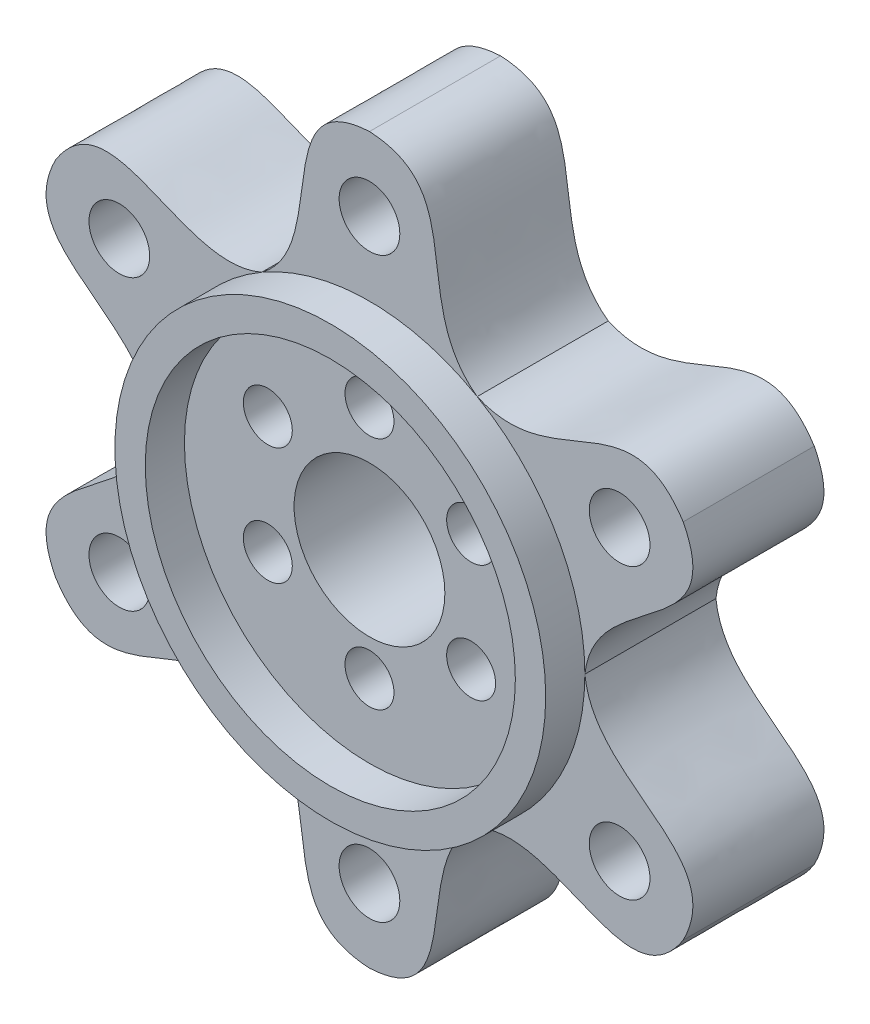
from build123d import *

# Parameters (mm, degrees)
SKETCH1_R           = 46.99
SKETCH1_R_2         = 9.779
SKETCH1_R_3         = 3.175
SKETCH1_R_4         = 3.937
BOSS_EXTRUDE3_DEPTH = 17.000000036
CUT_EXTRUDE1_START  = -22.86
CUT_EXTRUDE1_DEPTH  = 22.86
SKETCH4_R           = 27.94
SKETCH4_R_2         = 24.003
BOSS_EXTRUDE4_DEPTH = 5.08


with BuildPart() as part:
    # Sketch1 → Boss-Extrude3 (new body)
    with BuildSketch(Plane.XY):
        Circle(SKETCH1_R)
        Circle(SKETCH1_R_2, mode=Mode.SUBTRACT)
        with Locations((0, 16.002)):
            Circle(SKETCH1_R_3, mode=Mode.SUBTRACT)
        with Locations((13.184862266, 8.389716222)):
            Circle(SKETCH1_R_3, mode=Mode.SUBTRACT)
        with Locations((13.184862266, -6.834851335)):
            Circle(SKETCH1_R_3, mode=Mode.SUBTRACT)
        with Locations((0, -14.447135113)):
            Circle(SKETCH1_R_3, mode=Mode.SUBTRACT)
        with Locations((-13.184862266, -6.834851335)):
            Circle(SKETCH1_R_3, mode=Mode.SUBTRACT)
        with Locations((-13.184862266, 8.389716222)):
            Circle(SKETCH1_R_3, mode=Mode.SUBTRACT)
        with Locations((0, 37.465)):
            Circle(SKETCH1_R_4, mode=Mode.SUBTRACT)
        with Locations((32.445641753, 18.7325)):
            Circle(SKETCH1_R_4, mode=Mode.SUBTRACT)
        with Locations((32.445641753, -18.7325)):
            Circle(SKETCH1_R_4, mode=Mode.SUBTRACT)
        with Locations((0, -37.465)):
            Circle(SKETCH1_R_4, mode=Mode.SUBTRACT)
        with Locations((-32.445641753, -18.7325)):
            Circle(SKETCH1_R_4, mode=Mode.SUBTRACT)
        with Locations((-32.445641753, 18.7325)):
            Circle(SKETCH1_R_4, mode=Mode.SUBTRACT)
    extrude(amount=BOSS_EXTRUDE3_DEPTH)

    # Sketch2 → Cut-Extrude1 (cut)
    with BuildSketch(Plane.XY.offset(17.000000036).offset(CUT_EXTRUDE1_START)):
        with BuildLine():
            ThreePointArc((40.694533724, -23.495), (46.99, 0), (40.694533724, 23.495))
            add(Edge.make_bspline(
                [(27.94, 0), (29.161622986, 11.185280514), (46.712063944, 11.672076029), (40.694533724, 23.495)],
                knots=[0, 0, 0, 0, 1, 1, 1, 1], degree=3))
            add(Edge.make_bspline(
                [(27.94, 0), (29.161622986, -11.185280514), (46.712063944, -11.672076029), (40.694533724, -23.495)],
                knots=[0, 0, 0, 0, 1, 1, 1, 1], degree=3))
        make_face()
        with BuildLine():
            add(Edge.make_bspline(
                [(13.97, 24.196749782), (24.267548566, 19.662066064), (33.464346328, 34.617796024), (40.694533724, 23.495)],
                knots=[0, 0, 0, 0, 1, 1, 1, 1], degree=3))
            ThreePointArc((40.694533724, 23.495), (23.495, 40.694533724), (0, 46.99))
            add(Edge.make_bspline(
                [(13.97, 24.196749782), (4.894074419, 30.847346578), (13.247717616, 46.289872053), (0, 46.99)],
                knots=[0, 0, 0, 0, 1, 1, 1, 1], degree=3))
        make_face()
        with BuildLine():
            ThreePointArc((0, -46.99), (23.495, -40.694533724), (40.694533724, -23.495))
            add(Edge.make_bspline(
                [(13.97, -24.196749782), (24.267548566, -19.662066064), (33.464346328, -34.617796024), (40.694533724, -23.495)],
                knots=[0, 0, 0, 0, 1, 1, 1, 1], degree=3))
            add(Edge.make_bspline(
                [(13.97, -24.196749782), (4.894074419, -30.847346578), (13.247717616, -46.289872053), (0, -46.99)],
                knots=[0, 0, 0, 0, 1, 1, 1, 1], degree=3))
        make_face()
        with BuildLine():
            add(Edge.make_bspline(
                [(-13.97, 24.196749782), (-4.894074419, 30.847346578), (-13.247717616, 46.289872053), (0, 46.99)],
                knots=[0, 0, 0, 0, 1, 1, 1, 1], degree=3))
            ThreePointArc((0, 46.99), (-23.495, 40.694533724), (-40.694533724, 23.495))
            add(Edge.make_bspline(
                [(-13.97, 24.196749782), (-24.267548566, 19.662066064), (-33.464346328, 34.617796024), (-40.694533724, 23.495)],
                knots=[0, 0, 0, 0, 1, 1, 1, 1], degree=3))
        make_face()
        with BuildLine():
            ThreePointArc((-40.694533724, -23.495), (-23.495, -40.694533724), (0, -46.99))
            add(Edge.make_bspline(
                [(-13.97, -24.196749782), (-4.894074419, -30.847346578), (-13.247717616, -46.289872053), (0, -46.99)],
                knots=[0, 0, 0, 0, 1, 1, 1, 1], degree=3))
            add(Edge.make_bspline(
                [(-13.97, -24.196749782), (-24.267548566, -19.662066064), (-33.464346328, -34.617796024), (-40.694533724, -23.495)],
                knots=[0, 0, 0, 0, 1, 1, 1, 1], degree=3))
        make_face()
        with BuildLine():
            add(Edge.make_bspline(
                [(-27.94, 0), (-29.161622986, 11.185280514), (-46.712063944, 11.672076029), (-40.694533724, 23.495)],
                knots=[0, 0, 0, 0, 1, 1, 1, 1], degree=3))
            ThreePointArc((-40.694533724, 23.495), (-46.99, 0), (-40.694533724, -23.495))
            add(Edge.make_bspline(
                [(-27.94, 0), (-29.161622986, -11.185280514), (-46.712063944, -11.672076029), (-40.694533724, -23.495)],
                knots=[0, 0, 0, 0, 1, 1, 1, 1], degree=3))
        make_face()
    extrude(amount=CUT_EXTRUDE1_DEPTH, mode=Mode.SUBTRACT)

    # Sketch4 → Boss-Extrude4 (add)
    with BuildSketch(Plane.XY.offset(17.000000036)):
        Circle(SKETCH4_R)
        Circle(SKETCH4_R_2, mode=Mode.SUBTRACT)
    extrude(amount=BOSS_EXTRUDE4_DEPTH)


solid = part.part
